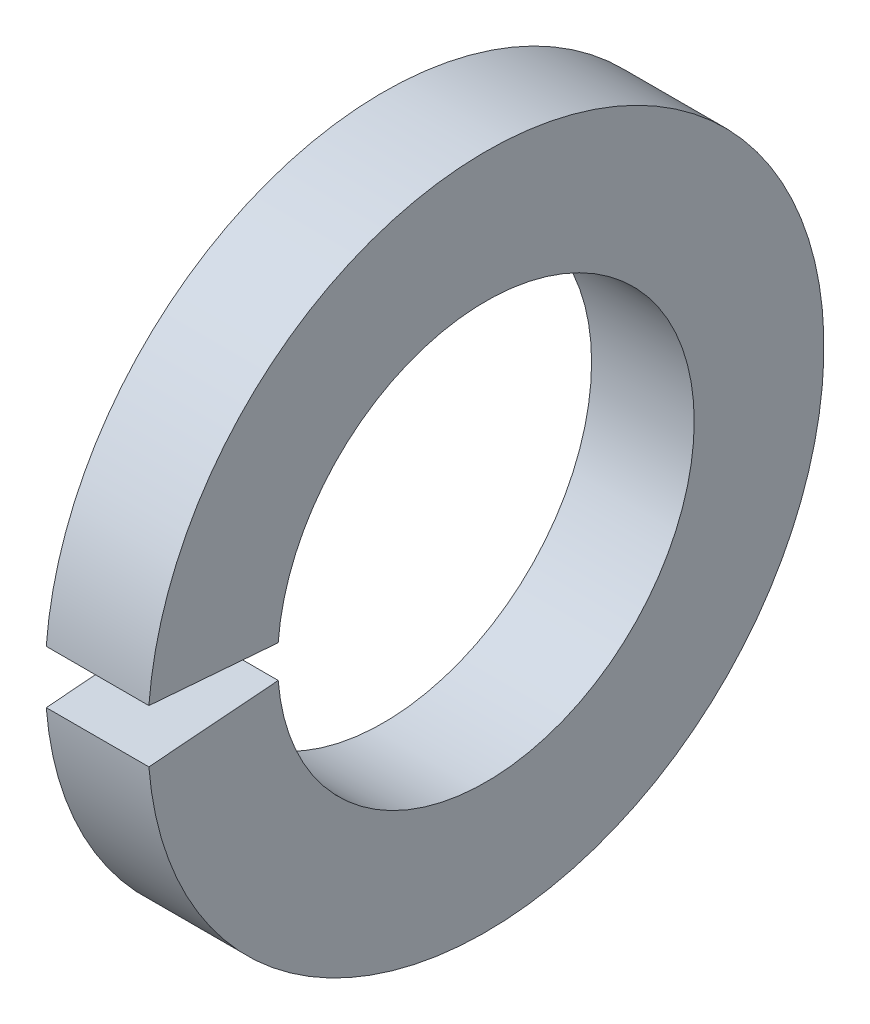
from build123d import *

# Parameters (mm, degrees)
SKETCH1_W = 6.35
SKETCH1_H = 8.0264
GAP_DEPTH = 31.254849384


with BuildPart() as part:
    # Sketch1 → Base-Revolve (revolve)
    with BuildSketch(Plane.XY):
        with Locations((-3.175, 16.9037)):
            Rectangle(SKETCH1_W, SKETCH1_H)
    revolve(axis=Axis((-34.925, 0, 0), (1, 0, 0)))

    # Sketch2 → Gap (cut, through all)
    with BuildSketch(Plane(origin=(0, 0, 0), x_dir=(0, -1, 0), z_dir=(-1, 0, 0))):
        with BuildLine():
            Line((0, 0), (1.673943481, 21.269468582))
            ThreePointArc((1.673943481, 21.269468582), (0, 21.335238), (-1.673943481, 21.269468582))
            Line((-1.673943481, 21.269468582), (0, 0))
        make_face()
    extrude(amount=GAP_DEPTH, mode=Mode.SUBTRACT)


solid = part.part
